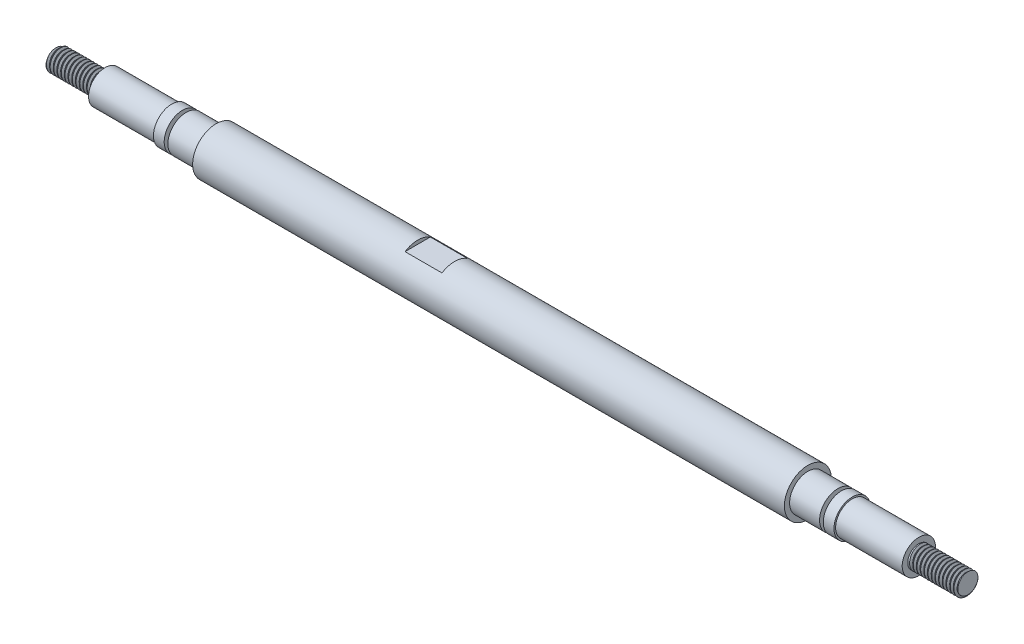
from build123d import *

# Parameters (mm, degrees)
SKETCH3_W          = 10
SKETCH3_H          = 1
CUT_EXTRUDE1_DEPTH = 5
THREAD3_PITCH      = 1
THREAD4_PITCH      = 1


with BuildPart() as part:
    # Sketch1 → Revolve1 (revolve)
    with BuildSketch(Plane.XY, mode=Mode.PRIVATE) as revolve1_sk:
        Polygon((0, 0), (0, 3), (13, 3), (13, 4.5), (31, 4.5), (31, 4.945), (33.9, 4.945), (33.9, 3.445), (34.9, 3.445), (34.9, 4.945), (43, 4.945), (43, 6.35), (203, 6.35), (203, 4.945), (211.1, 4.945), (211.1, 3.445), (212.1, 3.445), (212.1, 4.945), (215, 4.945), (215, 4.5), (233, 4.5), (233, 3), (246, 3), (246, 0), align=None)
    revolve(revolve1_sk.sketch.rotate(Axis((246, 0, 0), (-1, 0, 0)), 90), axis=Axis((246, 0, 0), (-1, 0, 0)))

    # Sketch3 → Cut-Extrude1 (cut, symmetric)
    with BuildSketch(Plane.XY):
        with Locations((102.5, 5.85)):
            Rectangle(SKETCH3_W, SKETCH3_H)
    extrude(amount=CUT_EXTRUDE1_DEPTH, both=True, mode=Mode.SUBTRACT)

    # Thread3: the profile of Thread Profile3 profile screwed along a right-hand helix of 13 turns, 8 arcs to a turn; built about Z, then put on its axis
    thread3_z = Axis((0, 0, 0), (0, 0, 1))
    thread3_corners = [(3.0003, 0, -0.000173205), (3.0003, 0, 0.875173202), (2.458734125, 0, 0.562499999), (2.458734125, 0, 0.312499999)]
    with BuildLine(mode=Mode.PRIVATE) as thread3_profile:
        Line(thread3_corners[0], thread3_corners[1])
        Line(thread3_corners[1], thread3_corners[2])
        Line(thread3_corners[2], thread3_corners[3])
        Line(thread3_corners[3], thread3_corners[0])
    thread3_cap = Face(thread3_profile.wire())
    thread3_turn_angles = [0, 22.5, 45, 67.5, 90, 112.5, 135, 157.5, 180, 202.5, 225, 247.5, 270, 292.5, 315, 337.5, 360]
    thread3_turn_weights = [1, 0.9238795325112867, 1, 0.9238795325112867, 1, 0.9238795325112867, 1, 0.9238795325112867, 1, 0.9238795325112867, 1, 0.9238795325112867, 1, 0.9238795325112867, 1, 0.9238795325112867, 1]
    thread3_turn_rails = [Edge.make_bspline([Vector(p[0], p[1], 0).rotate(thread3_z, thread3_turn_angles[k]) / thread3_turn_weights[k] + Vector(0, 0, p[2] + THREAD3_PITCH * thread3_turn_angles[k] / 360) for k in range(17)], [0, 0, 0, 1, 1, 2, 2, 3, 3, 4, 4, 5, 5, 6, 6, 7, 7, 8, 8, 8], 2, thread3_turn_weights) for p in thread3_corners]
    thread3_turn_sides = [Face.make_surface_from_curves(thread3_turn_rails[p[0]], thread3_turn_rails[p[1]]) for p in [(0, 1), (1, 2), (2, 3), (3, 0)]]
    thread3 = Plane(origin=(233, 0, 0), x_dir=(0, 0, -1), z_dir=(1, 0, 0)) * Solid(Shell([*[p.moved(Location((0, 0, THREAD3_PITCH * i))) for i in range(13) for p in thread3_turn_sides], thread3_cap, thread3_cap.rotate(thread3_z, 4680).moved(Location((0, 0, THREAD3_PITCH * 4680 / 360)))]))
    add(thread3, mode=Mode.SUBTRACT)

    # Thread4: the profile of Thread Profile4 profile screwed along a right-hand helix of 13 turns, 8 arcs to a turn; built about Z, then put on its axis
    thread4_z = Axis((0, 0, 0), (0, 0, 1))
    thread4_corners = [(3.0003, 0, -0.000173205), (3.0003, 0, 0.875173202), (2.458734125, 0, 0.562499999), (2.458734125, 0, 0.312499999)]
    with BuildLine(mode=Mode.PRIVATE) as thread4_profile:
        Line(thread4_corners[0], thread4_corners[1])
        Line(thread4_corners[1], thread4_corners[2])
        Line(thread4_corners[2], thread4_corners[3])
        Line(thread4_corners[3], thread4_corners[0])
    thread4_cap = Face(thread4_profile.wire())
    thread4_turn_angles = [0, 22.5, 45, 67.5, 90, 112.5, 135, 157.5, 180, 202.5, 225, 247.5, 270, 292.5, 315, 337.5, 360]
    thread4_turn_weights = [1, 0.9238795325112867, 1, 0.9238795325112867, 1, 0.9238795325112867, 1, 0.9238795325112867, 1, 0.9238795325112867, 1, 0.9238795325112867, 1, 0.9238795325112867, 1, 0.9238795325112867, 1]
    thread4_turn_rails = [Edge.make_bspline([Vector(p[0], p[1], 0).rotate(thread4_z, thread4_turn_angles[k]) / thread4_turn_weights[k] + Vector(0, 0, p[2] + THREAD4_PITCH * thread4_turn_angles[k] / 360) for k in range(17)], [0, 0, 0, 1, 1, 2, 2, 3, 3, 4, 4, 5, 5, 6, 6, 7, 7, 8, 8, 8], 2, thread4_turn_weights) for p in thread4_corners]
    thread4_turn_sides = [Face.make_surface_from_curves(thread4_turn_rails[p[0]], thread4_turn_rails[p[1]]) for p in [(0, 1), (1, 2), (2, 3), (3, 0)]]
    thread4 = Plane(origin=(13, 0, 0), x_dir=(0, 0, 1), z_dir=(-1, 0, 0)) * Solid(Shell([*[p.moved(Location((0, 0, THREAD4_PITCH * i))) for i in range(13) for p in thread4_turn_sides], thread4_cap, thread4_cap.rotate(thread4_z, 4680).moved(Location((0, 0, THREAD4_PITCH * 4680 / 360)))]))
    add(thread4, mode=Mode.SUBTRACT)


solid = part.part
